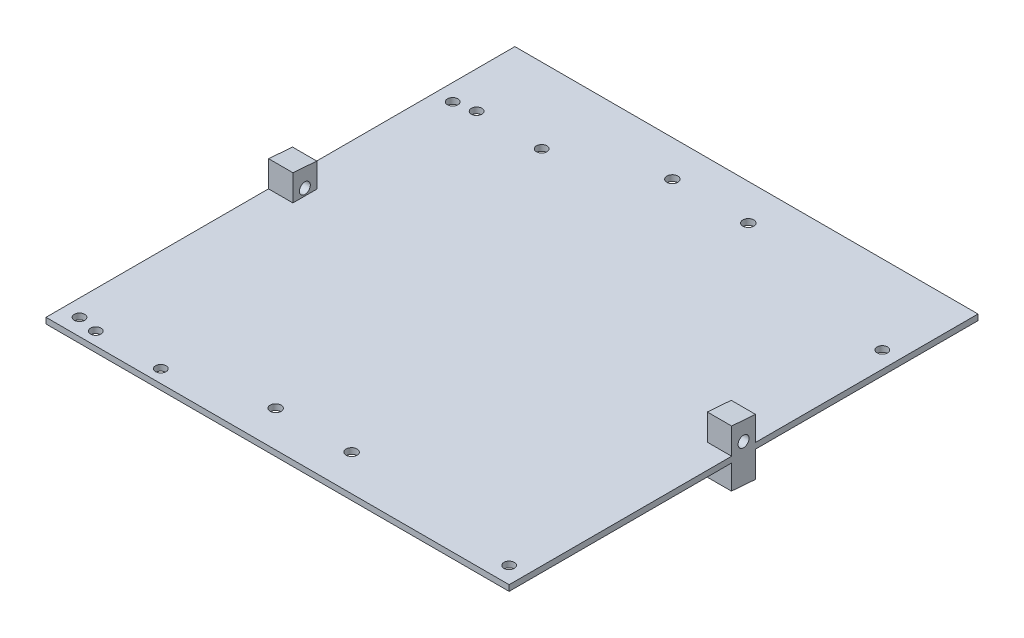
from build123d import *

# Parameters (mm, degrees)
SKETCH1_W           = 96.799999948
SKETCH1_H           = 98
BOSS_EXTRUDE1_DEPTH = 1.2192
CUT_EXTRUDE1_REACH  = 139.752
SKETCH5_R           = 1.0922
CUT_EXTRUDE2_REACH  = 139.752
SKETCH6_R           = 1.143
SKETCH10_W          = 5
SKETCH10_H          = 5.08
SKETCH10_R          = 1.143
BOSS_EXTRUDE2_DEPTH = 96.774
SKETCH13_W          = 86.614
SKETCH13_H          = 5
CUT_EXTRUDE3_DEPTH  = 5.08
BOSS_EXTRUDE3_DEPTH = 5.08
BOSS_EXTRUDE5_DEPTH = 5.08
BOSS_EXTRUDE6_DEPTH = 5.08
BOSS_EXTRUDE7_DEPTH = 5.08
BOSS_EXTRUDE8_DEPTH = 5.08


with BuildPart() as part:
    # Sketch1 → Boss-Extrude1 (new body)
    with BuildSketch(Plane(origin=(0, 0, 0), x_dir=(1, 0, 0), z_dir=(0, 1, 0))):
        with Locations((48.399999974, -49)):
            Rectangle(SKETCH1_W, SKETCH1_H)
    extrude(amount=BOSS_EXTRUDE1_DEPTH)

    # Sketch5 → Cut-Extrude1 (cut, up to next)
    with BuildSketch(Plane(origin=(0, 0, 0), x_dir=(-1, 0, 0), z_dir=(0, -1, 0)), mode=Mode.PRIVATE) as cut_extrude1_sk1:
        with Locations((-3.5, -94.5)):
            Circle(SKETCH5_R)
    cut_extrude1_tool1 = extrude(cut_extrude1_sk1.sketch, amount=-CUT_EXTRUDE1_REACH, mode=Mode.PRIVATE) & part.part
    # Sketch5 → Cut-Extrude1 (cut, up to next)
    with BuildSketch(Plane(origin=(0, 0, 0), x_dir=(-1, 0, 0), z_dir=(0, -1, 0)), mode=Mode.PRIVATE) as cut_extrude1_sk2:
        with Locations((-7.7, -95.3)):
            Circle(SKETCH5_R)
    cut_extrude1_tool2 = extrude(cut_extrude1_sk2.sketch, amount=-CUT_EXTRUDE1_REACH, mode=Mode.PRIVATE) & part.part
    # Sketch5 → Cut-Extrude1 (cut, up to next)
    with BuildSketch(Plane(origin=(0, 0, 0), x_dir=(-1, 0, 0), z_dir=(0, -1, 0)), mode=Mode.PRIVATE) as cut_extrude1_sk3:
        with Locations((-21.3, -95.3)):
            Circle(SKETCH5_R)
    cut_extrude1_tool3 = extrude(cut_extrude1_sk3.sketch, amount=-CUT_EXTRUDE1_REACH, mode=Mode.PRIVATE) & part.part
    # Sketch5 → Cut-Extrude1 (cut, up to next)
    with BuildSketch(Plane(origin=(0, 0, 0), x_dir=(-1, 0, 0), z_dir=(0, -1, 0)), mode=Mode.PRIVATE) as cut_extrude1_sk4:
        with Locations((-93.3, -94.5)):
            Circle(SKETCH5_R)
    cut_extrude1_tool4 = extrude(cut_extrude1_sk4.sketch, amount=-CUT_EXTRUDE1_REACH, mode=Mode.PRIVATE) & part.part
    # Sketch5 → Cut-Extrude1 (cut, up to next)
    with BuildSketch(Plane(origin=(0, 0, 0), x_dir=(-1, 0, 0), z_dir=(0, -1, 0)), mode=Mode.PRIVATE) as cut_extrude1_sk5:
        with Locations((-93.3, -16.5)):
            Circle(SKETCH5_R)
    cut_extrude1_tool5 = extrude(cut_extrude1_sk5.sketch, amount=-CUT_EXTRUDE1_REACH, mode=Mode.PRIVATE) & part.part
    # Sketch5 → Cut-Extrude1 (cut, up to next)
    with BuildSketch(Plane(origin=(0, 0, 0), x_dir=(-1, 0, 0), z_dir=(0, -1, 0)), mode=Mode.PRIVATE) as cut_extrude1_sk6:
        with Locations((-3.5, -16.5)):
            Circle(SKETCH5_R)
    cut_extrude1_tool6 = extrude(cut_extrude1_sk6.sketch, amount=-CUT_EXTRUDE1_REACH, mode=Mode.PRIVATE) & part.part
    # Sketch5 → Cut-Extrude1 (cut, up to next)
    with BuildSketch(Plane(origin=(0, 0, 0), x_dir=(-1, 0, 0), z_dir=(0, -1, 0)), mode=Mode.PRIVATE) as cut_extrude1_sk7:
        with Locations((-7.7, -15.7)):
            Circle(SKETCH5_R)
    cut_extrude1_tool7 = extrude(cut_extrude1_sk7.sketch, amount=-CUT_EXTRUDE1_REACH, mode=Mode.PRIVATE) & part.part
    # Sketch5 → Cut-Extrude1 (cut, up to next)
    with BuildSketch(Plane(origin=(0, 0, 0), x_dir=(-1, 0, 0), z_dir=(0, -1, 0)), mode=Mode.PRIVATE) as cut_extrude1_sk8:
        with Locations((-21.3, -15.7)):
            Circle(SKETCH5_R)
    cut_extrude1_tool8 = extrude(cut_extrude1_sk8.sketch, amount=-CUT_EXTRUDE1_REACH, mode=Mode.PRIVATE) & part.part
    add(cut_extrude1_tool1.solids().sort_by_distance((3.5, 0, 94.5))[0], mode=Mode.SUBTRACT)
    add(cut_extrude1_tool2.solids().sort_by_distance((7.7, 0, 95.3))[0], mode=Mode.SUBTRACT)
    add(cut_extrude1_tool3.solids().sort_by_distance((21.3, 0, 95.3))[0], mode=Mode.SUBTRACT)
    add(cut_extrude1_tool4.solids().sort_by_distance((93.3, 0, 94.5))[0], mode=Mode.SUBTRACT)
    add(cut_extrude1_tool5.solids().sort_by_distance((93.3, 0, 16.5))[0], mode=Mode.SUBTRACT)
    add(cut_extrude1_tool6.solids().sort_by_distance((3.5, 0, 16.5))[0], mode=Mode.SUBTRACT)
    add(cut_extrude1_tool7.solids().sort_by_distance((7.7, 0, 15.7))[0], mode=Mode.SUBTRACT)
    add(cut_extrude1_tool8.solids().sort_by_distance((21.3, 0, 15.7))[0], mode=Mode.SUBTRACT)

    # Sketch6 → Cut-Extrude2 (cut, up to next)
    with BuildSketch(Plane(origin=(0, 1.2192, 0), x_dir=(1, 0, 0), z_dir=(0, 1, 0)), mode=Mode.PRIVATE) as cut_extrude2_sk1:
        with Locations((56.337499948, -7.540625)):
            Circle(SKETCH6_R)
    cut_extrude2_tool1 = extrude(cut_extrude2_sk1.sketch, amount=-CUT_EXTRUDE2_REACH, mode=Mode.PRIVATE) & part.part
    # Sketch6 → Cut-Extrude2 (cut, up to next)
    with BuildSketch(Plane(origin=(0, 1.2192, 0), x_dir=(1, 0, 0), z_dir=(0, 1, 0)), mode=Mode.PRIVATE) as cut_extrude2_sk2:
        with Locations((40.462499948, -7.540625)):
            Circle(SKETCH6_R)
    cut_extrude2_tool2 = extrude(cut_extrude2_sk2.sketch, amount=-CUT_EXTRUDE2_REACH, mode=Mode.PRIVATE) & part.part
    # Sketch6 → Cut-Extrude2 (cut, up to next)
    with BuildSketch(Plane(origin=(0, 1.2192, 0), x_dir=(1, 0, 0), z_dir=(0, 1, 0)), mode=Mode.PRIVATE) as cut_extrude2_sk3:
        with Locations((40.462499948, -90.459375)):
            Circle(SKETCH6_R)
    cut_extrude2_tool3 = extrude(cut_extrude2_sk3.sketch, amount=-CUT_EXTRUDE2_REACH, mode=Mode.PRIVATE) & part.part
    # Sketch6 → Cut-Extrude2 (cut, up to next)
    with BuildSketch(Plane(origin=(0, 1.2192, 0), x_dir=(1, 0, 0), z_dir=(0, 1, 0)), mode=Mode.PRIVATE) as cut_extrude2_sk4:
        with Locations((56.337499948, -90.459375)):
            Circle(SKETCH6_R)
    cut_extrude2_tool4 = extrude(cut_extrude2_sk4.sketch, amount=-CUT_EXTRUDE2_REACH, mode=Mode.PRIVATE) & part.part
    add(cut_extrude2_tool1.solids().sort_by_distance((56.3375, 1.2192, 7.540625))[0], mode=Mode.SUBTRACT)
    add(cut_extrude2_tool2.solids().sort_by_distance((40.4625, 1.2192, 7.540625))[0], mode=Mode.SUBTRACT)
    add(cut_extrude2_tool3.solids().sort_by_distance((40.4625, 1.2192, 90.459375))[0], mode=Mode.SUBTRACT)
    add(cut_extrude2_tool4.solids().sort_by_distance((56.3375, 1.2192, 90.459375))[0], mode=Mode.SUBTRACT)

    # Sketch10 → Boss-Extrude2 (add)
    with BuildSketch(Plane(origin=(96.799999948, 0, 0), x_dir=(0, 0, -1), z_dir=(1, 0, 0))):
        with Locations((-49, 3.7592)):
            Rectangle(SKETCH10_W, SKETCH10_H)
        with Locations((-49, 2.64795)):
            Circle(SKETCH10_R, mode=Mode.SUBTRACT)
    extrude(amount=-BOSS_EXTRUDE2_DEPTH)

    # Sketch13 → Cut-Extrude3 (cut)
    with BuildSketch(Plane(origin=(0, 6.2992, 0), x_dir=(1, 0, 0), z_dir=(0, 1, 0))):
        with Locations((48.412999948, -49)):
            Rectangle(SKETCH13_W, SKETCH13_H)
    extrude(amount=-CUT_EXTRUDE3_DEPTH, mode=Mode.SUBTRACT)

    # Sketch14 → Boss-Extrude3 (add)
    with BuildSketch(Plane.XZ):
        Polygon((0, 49), (0, 51.54), (5.08, 51.54), (5.08, 46.46), (0, 46.46), align=None)
        Polygon((96.799999948, 49), (96.799999948, 51.54), (91.719999948, 51.54), (91.719999948, 46.46), (96.799999948, 46.46), align=None)
    extrude(amount=BOSS_EXTRUDE3_DEPTH)

    # Sketch15 → Boss-Extrude5 (add)
    with BuildSketch(Plane.ZY):
        Polygon((51.54, -5.08), (46.46, -5.08), (46.46, -5.479804671), align=None)
    extrude(amount=-BOSS_EXTRUDE5_DEPTH)

    # Sketch16 → Boss-Extrude6 (add)
    with BuildSketch(Plane(origin=(96.799999948, 0, 0), x_dir=(0, 0, -1), z_dir=(1, 0, 0))):
        Polygon((-46.46, -5.08), (-51.54, -5.08), (-46.46, -5.479804671), align=None)
    extrude(amount=-BOSS_EXTRUDE6_DEPTH)

    # Sketch17 → Boss-Extrude7 (add)
    with BuildSketch(Plane(origin=(96.799999948, 0, 0), x_dir=(0, 0, -1), z_dir=(1, 0, 0))):
        Polygon((-46.5, 6.2992), (-51.5, 6.2992), (-51.5, 6.692708534), align=None)
    extrude(amount=-BOSS_EXTRUDE7_DEPTH)

    # Sketch18 → Boss-Extrude8 (add)
    with BuildSketch(Plane.ZY.offset(-0.025999948)):
        Polygon((46.5, 6.2992), (51.5, 6.2992), (51.5, 6.692708534), align=None)
    extrude(amount=-BOSS_EXTRUDE8_DEPTH)


solid = part.part
